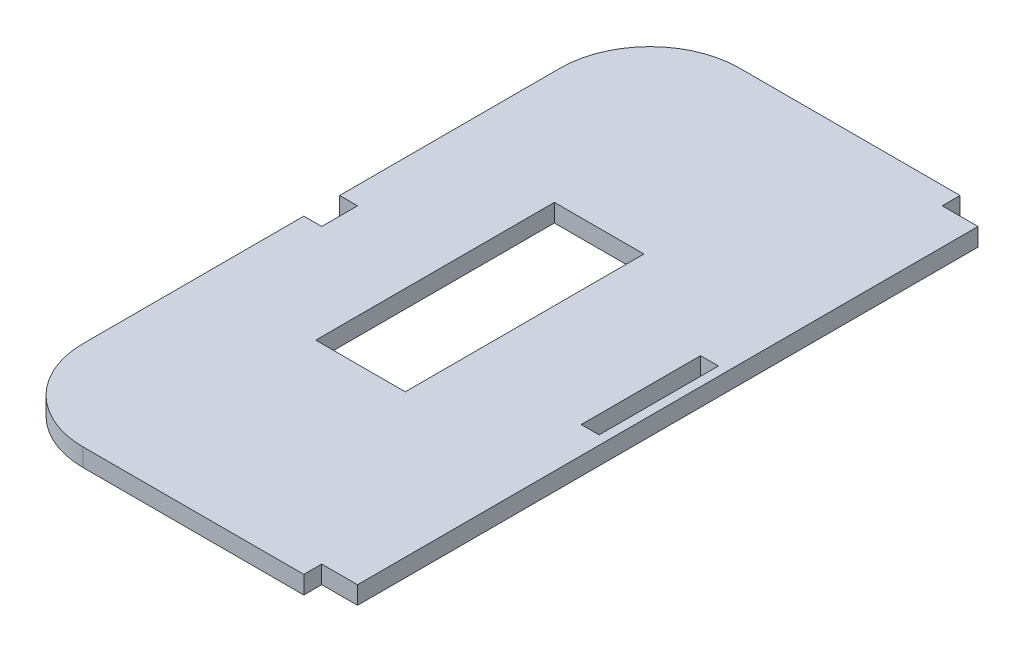
from build123d import *

# Parameters (mm, degrees)
EXTRUDE_3_DEPTH    = 3
SKETCH1_W          = 15
SKETCH1_H          = 40
SKETCH1_W_2        = 3
SKETCH1_H_2        = 20
CUT_EXTRUDE1_DEPTH = 10
FILLET1_R          = 15


with BuildPart() as part:
    # Эскиз4 → Бобышка-Вытянуть3 (new body)
    with BuildSketch(Plane(origin=(0, 0, 0), x_dir=(1, 0, 0), z_dir=(0, 1, 0))):
        Polygon((0, 110), (0, 58), (3, 58), (3, 52), (0, 52), (0, 0), (52, 0), (52, 3), (58, 3), (58, 107), (52, 107), (52, 110), align=None)
    extrude(amount=EXTRUDE_3_DEPTH)

    # Sketch1 → Cut-Extrude1 (cut)
    with BuildSketch(Plane(origin=(0, 3, 0), x_dir=(1, 0, 0), z_dir=(0, 1, 0))):
        with Locations((26.5, 55)):
            Rectangle(SKETCH1_W, SKETCH1_H)
        with Locations((55, 55)):
            Rectangle(SKETCH1_W_2, SKETCH1_H_2)
    extrude(amount=-CUT_EXTRUDE1_DEPTH, mode=Mode.SUBTRACT)

    # Fillet1
    fillet1_edges = [part.edges().sort_by_distance(p)[0] for p in [
        (0, 1.5, 0),
        (0, 1.5, -110),
    ]]
    fillet(fillet1_edges, radius=FILLET1_R)


solid = part.part
